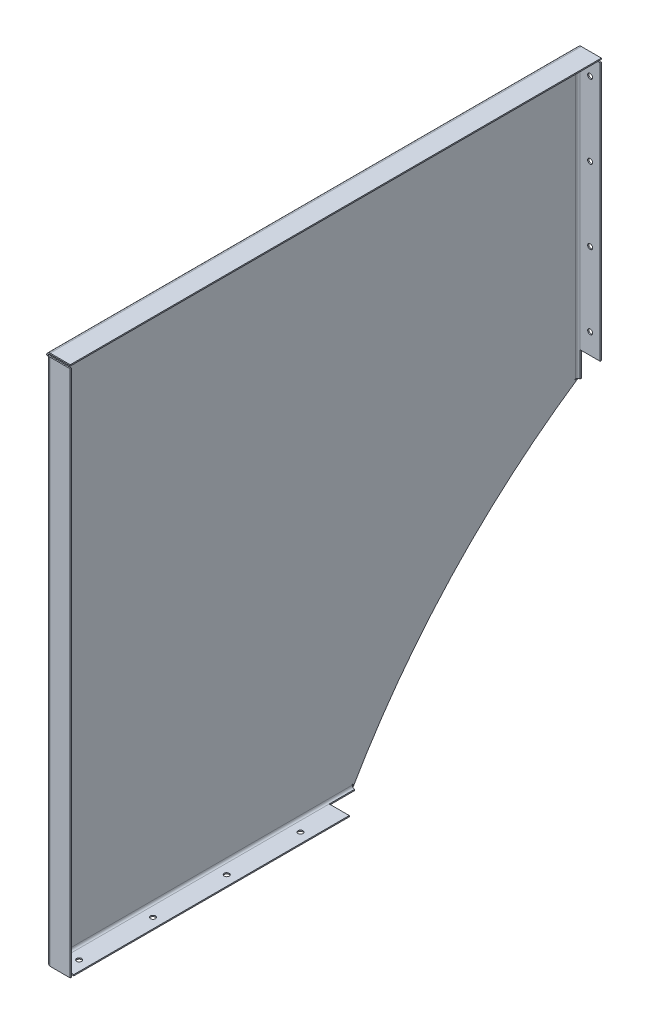
from build123d import *

# Parameters (mm, degrees)
BASE_FLANGE1_DEPTH           = 2
EDGE_FLANGE1_STRIP_W         = 16
EDGE_FLANGE1_STRIP_H         = 2
EDGE_FLANGE1_STRIP_CUT_DEPTH = 900
EDGE_FLANGE1_DEPTH           = 900
EDGE_FLANGE2_STRIP_W         = 16
EDGE_FLANGE2_STRIP_H         = 2
EDGE_FLANGE2_STRIP_CUT_DEPTH = 894
EDGE_FLANGE2_DEPTH           = 894
EDGE_FLANGE3_START           = 4681.953522875
EDGE_FLANGE3_DEPTH           = 510.829009869
EDGE_FLANGE3_2_DEPTH         = 1
EDGE_FLANGE3_START_2         = 4682.953522875
EDGE_FLANGE3_3_DEPTH         = 509.829009869
EDGE_FLANGE4_START           = 228.014810269
EDGE_FLANGE4_DEPTH           = 482.051021673
EDGE_FLANGE4_2_DEPTH         = 1
EDGE_FLANGE4_START_2         = 229.014810269
EDGE_FLANGE4_3_DEPTH         = 481.051021673
SKETCH18_W                   = 34
SKETCH18_H                   = 43
CUT_EXTRUDE1_DEPTH           = 10
SKETCH19_W                   = 34
SKETCH19_H                   = 43
CUT_EXTRUDE2_DEPTH           = 10
SKETCH20_R                   = 4.25
CUT_EXTRUDE3_DEPTH           = 10
SKETCH21_R                   = 4.25
CUT_EXTRUDE4_DEPTH           = 10


# Read off the part's stored shape, not the designer's step: Edge-Flange3, Edge-Flange4
# Sheet-metal steps are written as plain solids
with BuildPart() as part:
    # Sketch1 → Base-Flange1 (new body)
    with BuildSketch(Plane(origin=(0, 0, 0), x_dir=(0, 0, -1), z_dir=(1, 0, 0))):
        with BuildLine():
            Line((-4682.953522875, -183.934168058), (-5198.782532744, -183.934168058))
            Line((-5198.782532744, -183.934168058), (-5198.782532744, 716.065831942))
            Line((-5198.782532744, 716.065831942), (-4298.782532744, 716.065831942))
            Line((-4298.782532744, 716.065831942), (-4298.782532744, 229.014810269))
            ThreePointArc((-4298.782532744, 229.014810269), (-4514.658558014, 44.672913809), (-4682.953522875, -183.934168058))
        make_face()
    extrude(amount=-BASE_FLANGE1_DEPTH)

    # Edge-Flange1 strip (across the edge) → Edge-Flange1 strip cut (cut)
    with BuildSketch(Plane(origin=(0, 716.065831942, 4298.782532744), x_dir=(0, -1, 0), z_dir=(0, 0, 1))):
        with Locations((-2, -1)):
            Rectangle(EDGE_FLANGE1_STRIP_W, EDGE_FLANGE1_STRIP_H)
    extrude(amount=EDGE_FLANGE1_STRIP_CUT_DEPTH, mode=Mode.SUBTRACT)

    # Edge-Flange1 section (across the edge) → Edge-Flange1 (add)
    with BuildSketch(Plane(origin=(0, 716.065831942, 4298.782532744), x_dir=(0, -1, 0), z_dir=(0, 0, 1))):
        with BuildLine():
            Line((0, 4), (0, 38))
            Line((0, 38), (2, 38))
            Line((2, 38), (2, 4))
            ThreePointArc((2, 4), (3.171572875, 1.171572875), (6, 0))
            Line((6, 0), (6, -2))
            ThreePointArc((6, -2), (1.757359313, -0.242640687), (0, 4))
        make_face()
    extrude(amount=EDGE_FLANGE1_DEPTH)

    # Edge-Flange2 strip (across the edge) → Edge-Flange2 strip cut (cut)
    with BuildSketch(Plane(origin=(0, 710.065831942, 5198.782532744), x_dir=(0, 0, -1), z_dir=(0, -1, 0))):
        with Locations((-2, -1)):
            Rectangle(EDGE_FLANGE2_STRIP_W, EDGE_FLANGE2_STRIP_H)
    extrude(amount=EDGE_FLANGE2_STRIP_CUT_DEPTH, mode=Mode.SUBTRACT)

    # Edge-Flange2 section (across the edge) → Edge-Flange2 (add)
    with BuildSketch(Plane(origin=(0, 710.065831942, 5198.782532744), x_dir=(0, 0, -1), z_dir=(0, -1, 0))):
        with BuildLine():
            Line((0, 4), (0, 38))
            Line((0, 38), (2, 38))
            Line((2, 38), (2, 4))
            ThreePointArc((2, 4), (3.171572875, 1.171572875), (6, 0))
            Line((6, 0), (6, -2))
            ThreePointArc((6, -2), (1.757359313, -0.242640687), (0, 4))
        make_face()
    extrude(amount=EDGE_FLANGE2_DEPTH)

    # Edge-Flange3 outline → Edge-Flange3 (cut)
    with BuildSketch(Plane.XY.offset(EDGE_FLANGE3_START)):
        with BuildLine():
            Line((0, -183.934168058), (0, -182.406304013))
            ThreePointArc((0, -182.406304013), (-1.477225575, -180.383657801), (-2, -177.934168058))
            Line((-2, -177.934168058), (-2, -183.934168058))
            Line((-2, -183.934168058), (0, -183.934168058))
        make_face()
    extrude(amount=EDGE_FLANGE3_DEPTH, mode=Mode.SUBTRACT)

    # Edge-Flange3 2 outline → Edge-Flange3 2 (cut)
    with BuildSketch(Plane.XY.offset(EDGE_FLANGE3_START)):
        with BuildLine():
            Line((0, -182.406304013), (0, -176.934168058))
            Line((0, -176.934168058), (-2, -176.934168058))
            Line((-2, -176.934168058), (-2, -177.934168058))
            ThreePointArc((-2, -177.934168058), (-1.477225575, -180.383657801), (0, -182.406304013))
        make_face()
    extrude(amount=EDGE_FLANGE3_2_DEPTH, mode=Mode.SUBTRACT)

    # Edge-Flange3 3 outline → Edge-Flange3 3 (add)
    with BuildSketch(Plane.XY.offset(EDGE_FLANGE3_START_2)):
        with BuildLine():
            Line((38, -183.934168058), (38, -181.934168058))
            Line((38, -181.934168058), (4, -181.934168058))
            ThreePointArc((4, -181.934168058), (1.171572875, -180.762595183), (0, -177.934168058))
            Line((0, -177.934168058), (0, -182.406304013))
            ThreePointArc((0, -182.406304013), (1.859067461, -183.539202212), (4, -183.934168058))
            Line((4, -183.934168058), (38, -183.934168058))
        make_face()
    extrude(amount=EDGE_FLANGE3_3_DEPTH)

    # Edge-Flange4 outline → Edge-Flange4 (cut)
    with BuildSketch(Plane(origin=(0, 0, 0), x_dir=(1, 0, 0), z_dir=(0, 1, 0)).offset(EDGE_FLANGE4_START)):
        with BuildLine():
            ThreePointArc((-2, -4304.782532744), (-1.477225575, -4302.333043001), (0, -4300.310396789))
            Line((0, -4300.310396789), (0, -4298.782532744))
            Line((0, -4298.782532744), (-2, -4298.782532744))
            Line((-2, -4298.782532744), (-2, -4304.782532744))
        make_face()
    extrude(amount=EDGE_FLANGE4_DEPTH, mode=Mode.SUBTRACT)

    # Edge-Flange4 2 outline → Edge-Flange4 2 (cut)
    with BuildSketch(Plane(origin=(0, 0, 0), x_dir=(1, 0, 0), z_dir=(0, 1, 0)).offset(EDGE_FLANGE4_START)):
        with BuildLine():
            Line((0, -4305.782532744), (0, -4300.310396789))
            ThreePointArc((0, -4300.310396789), (-1.477225575, -4302.333043001), (-2, -4304.782532744))
            Line((-2, -4304.782532744), (-2, -4305.782532744))
            Line((-2, -4305.782532744), (0, -4305.782532744))
        make_face()
    extrude(amount=EDGE_FLANGE4_2_DEPTH, mode=Mode.SUBTRACT)

    # Edge-Flange4 3 outline → Edge-Flange4 3 (add)
    with BuildSketch(Plane(origin=(0, 0, 0), x_dir=(1, 0, 0), z_dir=(0, 1, 0)).offset(EDGE_FLANGE4_START_2)):
        with BuildLine():
            Line((38, -4298.782532744), (4, -4298.782532744))
            ThreePointArc((4, -4298.782532744), (1.859067461, -4299.17749859), (0, -4300.310396789))
            Line((0, -4300.310396789), (0, -4304.782532744))
            ThreePointArc((0, -4304.782532744), (1.171572875, -4301.954105619), (4, -4300.782532744))
            Line((4, -4300.782532744), (38, -4300.782532744))
            Line((38, -4300.782532744), (38, -4298.782532744))
        make_face()
    extrude(amount=EDGE_FLANGE4_3_DEPTH)

    # Sketch18 → Cut-Extrude1 (cut)
    with BuildSketch(Plane.XZ.offset(183.934168058)):
        with Locations((21, 4704.453522875)):
            Rectangle(SKETCH18_W, SKETCH18_H)
    extrude(amount=-CUT_EXTRUDE1_DEPTH, mode=Mode.SUBTRACT)

    # Sketch19 → Cut-Extrude2 (cut)
    with BuildSketch(Plane(origin=(0, 0, 4298.782532744), x_dir=(-1, 0, 0), z_dir=(0, 0, -1))):
        with Locations((-21, 250.514810269)):
            Rectangle(SKETCH19_W, SKETCH19_H)
    extrude(amount=-CUT_EXTRUDE2_DEPTH, mode=Mode.SUBTRACT)

    # Sketch20 → Cut-Extrude3 (cut)
    with BuildSketch(Plane.XZ.offset(183.934168058)):
        with Locations((21, 5166.632532744)):
            Circle(SKETCH20_R)
        with Locations((21, 5041.632532744)):
            Circle(SKETCH20_R)
        with Locations((21, 4916.632532744)):
            Circle(SKETCH20_R)
        with Locations((21, 4791.632532744)):
            Circle(SKETCH20_R)
    extrude(amount=-CUT_EXTRUDE3_DEPTH, mode=Mode.SUBTRACT)

    # Sketch21 → Cut-Extrude4 (cut)
    with BuildSketch(Plane(origin=(0, 0, 4298.782532744), x_dir=(-1, 0, 0), z_dir=(0, 0, -1))):
        with Locations(Location((-21, 681.915831942, 0), (0, 0, 90))):
            Circle(SKETCH21_R)
        with Locations(Location((-21, 556.915831942, 0), (0, 0, 90))):
            Circle(SKETCH21_R)
        with Locations(Location((-21, 431.915831942, 0), (0, 0, 90))):
            Circle(SKETCH21_R)
        with Locations(Location((-21, 306.915831942, 0), (0, 0, 90))):
            Circle(SKETCH21_R)
    extrude(amount=-CUT_EXTRUDE4_DEPTH, mode=Mode.SUBTRACT)


solid = part.part
